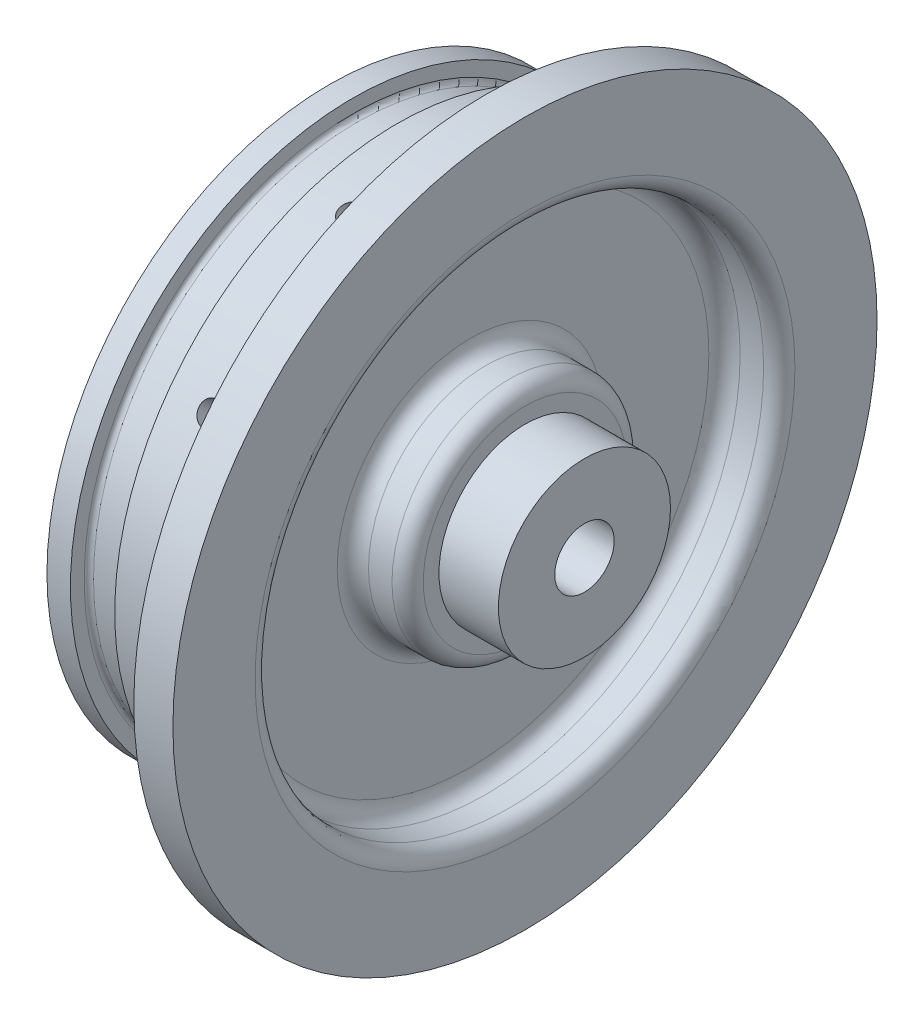
from build123d import *

# Parameters (mm, degrees)
SKETCH1_R           = 57.15
BOSS_EXTRUDE1_DEPTH = 6.35
SKETCH2_R           = 45.847
BOSS_EXTRUDE2_DEPTH = 25.4
SKETCH11_R          = 1.89865
CUT_EXTRUDE3_DEPTH  = 10.16
CIRPATTERN1_COUNT   = 10
SKETCH15_R          = 4.826
CUT_EXTRUDE4_DEPTH  = 87.83494404
BOSS_EXTRUDE3_START = 9.652
SKETCH17_R          = 13.97
SKETCH17_R_2        = 4.826
BOSS_EXTRUDE3_DEPTH = 9.652
SKETCH18_W          = 8.89
SKETCH18_H          = 22.225
FILLET1_R           = 2.54


with BuildPart() as part:
    # Sketch1 → Boss-Extrude1 (new body)
    with BuildSketch(Plane(origin=(0, 0, 0), x_dir=(0, 0, -1), z_dir=(1, 0, 0))):
        Circle(SKETCH1_R)
    extrude(amount=BOSS_EXTRUDE1_DEPTH)

    # Sketch2 → Boss-Extrude2 (add)
    with BuildSketch(Plane.ZY):
        Circle(SKETCH2_R)
    extrude(amount=BOSS_EXTRUDE2_DEPTH)

    # Sketch11 → Cut-Extrude3 (cut)
    with BuildSketch(Plane(origin=(0, 0, -45.847), x_dir=(-1, 0, 0), z_dir=(0, 0, -1))):
        with Locations((7.62, 0)):
            Circle(SKETCH11_R)
    cut_extrude3 = extrude(amount=-CUT_EXTRUDE3_DEPTH, mode=Mode.SUBTRACT)

    # CirPattern1: Cut-Extrude3 ×10 about axis
    cirpattern1_axis = Axis((0, 0, 0), (-1, 0, 0))
    for i in range(1, CIRPATTERN1_COUNT):
        add(cut_extrude3.rotate(cirpattern1_axis, i * 360 / CIRPATTERN1_COUNT), mode=Mode.SUBTRACT)

    # Sketch15 → Cut-Extrude4 (cut, through all)
    with BuildSketch(Plane(origin=(6.35, 0, 0), x_dir=(0, 0, -1), z_dir=(1, 0, 0))):
        Circle(SKETCH15_R)
    extrude(amount=-CUT_EXTRUDE4_DEPTH, mode=Mode.SUBTRACT)

    # Sketch16 → Cut-Revolve1 (revolve, cut)
    with BuildSketch(Plane.XY):
        with BuildLine():
            Line((-21.59, 45.847), (-14.4018, 45.847))
            Line((-14.4018, 45.847), (-14.4018, 43.6245))
            ThreePointArc((-14.4018, 43.6245), (-14.624984633, 43.085684633), (-15.1638, 42.8625))
            Line((-15.1638, 42.8625), (-20.828, 42.8625))
            ThreePointArc((-20.828, 42.8625), (-21.366815367, 43.085684633), (-21.59, 43.6245))
            Line((-21.59, 43.6245), (-21.59, 45.847))
        make_face()
    revolve(axis=Axis((0, 0, 0), (-1, 0, 0)), mode=Mode.SUBTRACT)

    # Sketch17 → Boss-Extrude3 (add)
    with BuildSketch(Plane(origin=(6.35, 0, 0), x_dir=(0, 0, -1), z_dir=(1, 0, 0)).offset(BOSS_EXTRUDE3_START)):
        Circle(SKETCH17_R)
        Circle(SKETCH17_R_2, mode=Mode.SUBTRACT)
    extrude(amount=-BOSS_EXTRUDE3_DEPTH)

    # Sketch18 → Cut-Revolve2 (revolve, cut)
    with BuildSketch(Plane.XY):
        with Locations((1.905, 30.1625)):
            Rectangle(SKETCH18_W, SKETCH18_H)
    revolve(axis=Axis((0, 0, 0), (-1, 0, 0)), mode=Mode.SUBTRACT)

    # Fillet1
    fillet1_edges = [part.edges().sort_by_distance(p)[0] for p in [
        (6.35, -41.275, 0),
        (-2.54, -41.275, 0),
        (-2.54, -19.05, 0),
        (6.35, -19.05, 0),
    ]]
    fillet(fillet1_edges, radius=FILLET1_R)


solid = part.part
